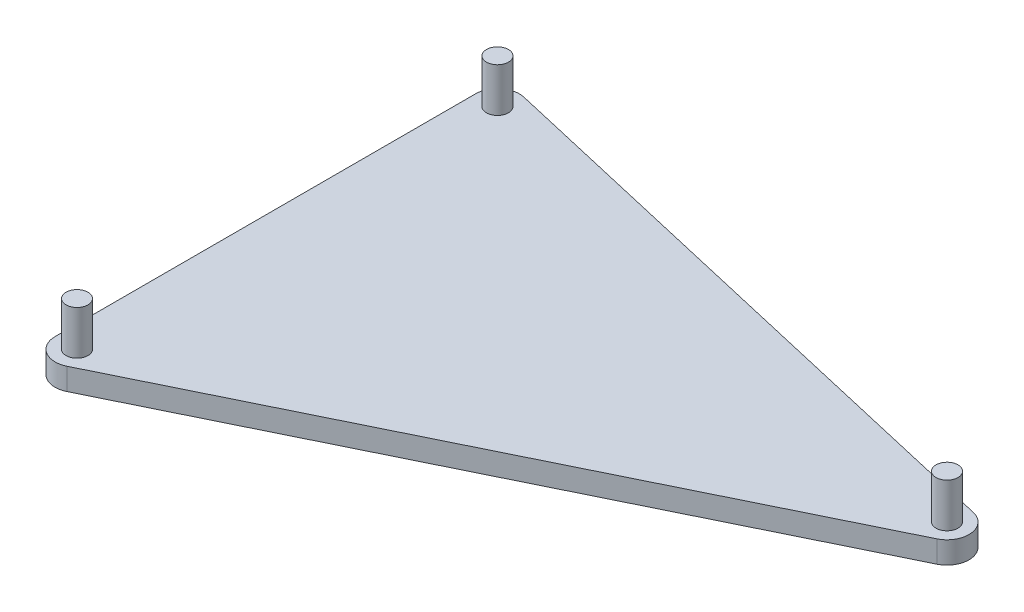
from build123d import *

# Parameters (mm, degrees)
SKETCH1_R                = 5
BOSS_EXTRUDE1_DEPTH      = 5
BOSS_EXTRUDE2_DEPTH      = 25
BOSS_EXTRUDE2_DEPTH_BACK = 5
SKETCH3_R                = 5


with BuildPart() as part:
    # Sketch1 → Boss-Extrude1 (new, symmetric)
    with BuildSketch(Plane(origin=(0, 0, 0), x_dir=(1, 0, 0), z_dir=(0, 1, 0))):
        with BuildLine():
            Line((-276.16, -130), (-276.16, 61.45))
            ThreePointArc((-276.16, 61.45), (-272.385116744, 69.276105131), (-263.910415696, 71.193683619))
            Line((-263.910415696, 71.193683619), (2.249584304, 9.743683619))
            ThreePointArc((2.249584304, 9.743683619), (9.935404568, 1.134784593), (4.388758686, -8.985477015))
            Line((4.388758686, -8.985477015), (-261.771241314, -138.985477015))
            ThreePointArc((-261.771241314, -138.985477015), (-271.456810981, -138.481968724), (-276.16, -130))
        make_face()
        with Locations((-266.16, 61.45)):
            Circle(SKETCH1_R, mode=Mode.SUBTRACT)
        Circle(SKETCH1_R, mode=Mode.SUBTRACT)
        with Locations((-266.16, -130)):
            Circle(SKETCH1_R, mode=Mode.SUBTRACT)
    extrude(amount=BOSS_EXTRUDE1_DEPTH, both=True)

    # Sketch3 → Boss-Extrude2 (add, two sides: drawn at the far end of the back side and taken through both)
    with BuildSketch(Plane(origin=(0, 0, 0), x_dir=(1, 0, 0), z_dir=(0, 1, 0)).offset(-BOSS_EXTRUDE2_DEPTH_BACK)):
        with Locations((-266.16, 61.45)):
            Circle(SKETCH3_R)
        Circle(SKETCH3_R)
        with Locations((-266.16, -130)):
            Circle(SKETCH3_R)
    extrude(amount=BOSS_EXTRUDE2_DEPTH + BOSS_EXTRUDE2_DEPTH_BACK)


solid = part.part
